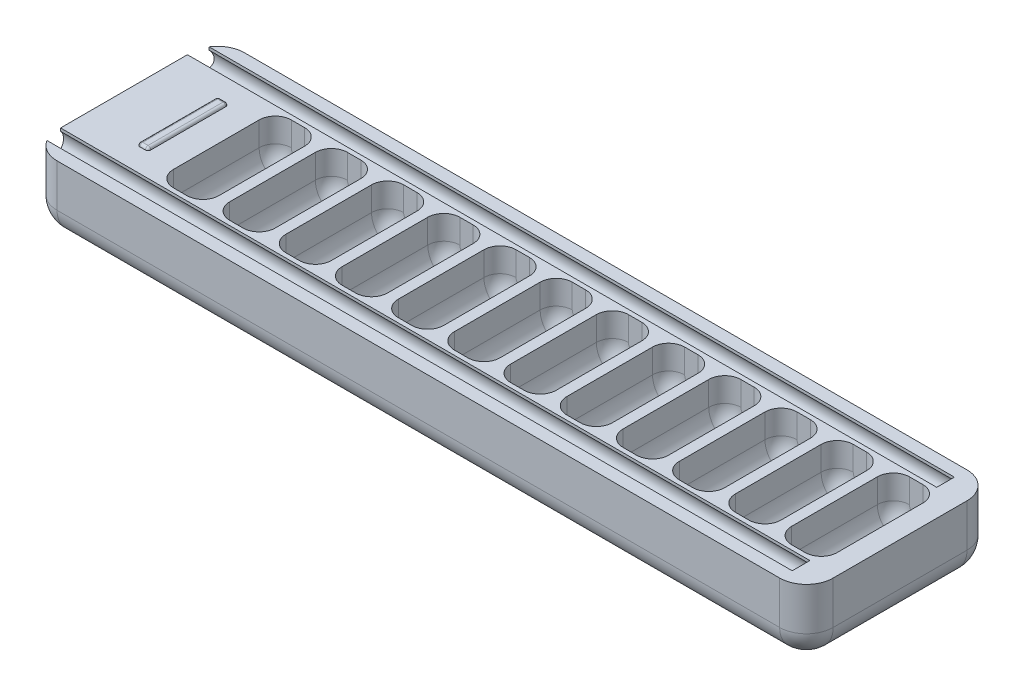
from build123d import *

# Parameters (mm, degrees)
SKETCH_1_W             = 145
SKETCH_1_H             = 35
EXTRUDE_1_DEPTH        = 13
FILLET_1_R             = 5
FILLET_2_R             = 5
CUT_EXTRUDE_1_DEPTH    = 11
PATTERN_LINEAR_1_COUNT = 12
PATTERN_LINEAR_1_PITCH = 10.5
SKETCH_3_R             = 2.2
SKETCH_3_W             = 3.3
SKETCH_3_H             = 4.4
CUT_EXTRUDE_2_DEPTH    = 140
FILLET_3_R             = 3
FILLET_4_R             = 3
SKETCH_4_W             = 2
SKETCH_4_H             = 15
EXTRUDE_2_DEPTH        = 0.5
FILLET_5_R             = 0.5


# Some blends are built 0.0001 mm under size
with BuildPart() as part:
    # 草图1 → 凸台-拉伸1 (new body)
    with BuildSketch(Plane(origin=(0, 0, 0), x_dir=(1, 0, 0), z_dir=(0, 1, 0))):
        Rectangle(SKETCH_1_W, SKETCH_1_H)
    extrude(amount=EXTRUDE_1_DEPTH)

    # 圆角1
    fillet_1_edges = [part.edges().sort_by_distance(p)[0] for p in [
        (0, 0, 17.5),
        (-72.5, 0, 0),
        (0, 0, -17.5),
        (72.5, 0, 0),
    ]]
    fillet(fillet_1_edges, radius=FILLET_1_R)

    # 圆角2
    # the kernel refuses this fillet: 5 mm, written as the material it takes off along each edge
    with BuildSketch(Plane(origin=(67.5, 5, -12.5), x_dir=(1, 0, 0), z_dir=(0, 0, -1))) as fillet_2_piece_1_section:
        Polygon((0, 0), (FILLET_2_R, 0), (FILLET_2_R, FILLET_2_R), (0, FILLET_2_R), align=None)
    fillet_2_piece_1 = extrude(amount=FILLET_2_R, mode=Mode.PRIVATE)
    fillet_2_piece_1 = fillet_2_piece_1 - Plane(origin=(67.5, 5, -12.5), x_dir=(-0.7071067811865475, 0.7071067811865475, 0), z_dir=(0, 0, -1)) * Sphere(FILLET_2_R, mode=Mode.PRIVATE)
    add(fillet_2_piece_1, mode=Mode.SUBTRACT)
    with BuildSketch(Plane(origin=(67.5, 5, 12.5), x_dir=(0, 0, 1), z_dir=(1, 0, 0))) as fillet_2_piece_2_section:
        Polygon((0, 0), (FILLET_2_R, 0), (FILLET_2_R, FILLET_2_R), (0, FILLET_2_R), align=None)
    fillet_2_piece_2 = extrude(amount=FILLET_2_R, mode=Mode.PRIVATE)
    fillet_2_piece_2 = fillet_2_piece_2 - Plane(origin=(67.5, 5, 12.5), x_dir=(0, 0.7071067811865475, -0.7071067811865475), z_dir=(1, 0, 0)) * Sphere(FILLET_2_R, mode=Mode.PRIVATE)
    add(fillet_2_piece_2, mode=Mode.SUBTRACT)
    with BuildSketch(Plane(origin=(-67.5, 5, -12.5), x_dir=(-1, 0, 0), z_dir=(0, 0, -1))) as fillet_2_piece_3_section:
        Polygon((0, 0), (FILLET_2_R, 0), (FILLET_2_R, -FILLET_2_R), (0, -FILLET_2_R), align=None)
    fillet_2_piece_3 = extrude(amount=FILLET_2_R, mode=Mode.PRIVATE)
    fillet_2_piece_3 = fillet_2_piece_3 - Plane(origin=(-67.5, 5, -12.5), x_dir=(0.7071067811865475, 0.7071067811865475, 0), z_dir=(0, 0, -1)) * Sphere(FILLET_2_R, mode=Mode.PRIVATE)
    add(fillet_2_piece_3, mode=Mode.SUBTRACT)
    with BuildSketch(Plane(origin=(-67.5, 5, 12.5), x_dir=(0, 0, 1), z_dir=(-1, 0, 0))) as fillet_2_piece_4_section:
        Polygon((0, 0), (FILLET_2_R, 0), (FILLET_2_R, -FILLET_2_R), (0, -FILLET_2_R), align=None)
    fillet_2_piece_4 = extrude(amount=FILLET_2_R, mode=Mode.PRIVATE)
    fillet_2_piece_4 = fillet_2_piece_4 - Plane(origin=(-67.5, 5, 12.5), x_dir=(0, 0.7071067811865475, -0.7071067811865475), z_dir=(-1, 0, 0)) * Sphere(FILLET_2_R, mode=Mode.PRIVATE)
    add(fillet_2_piece_4, mode=Mode.SUBTRACT)
    with BuildSketch(Plane(origin=(72.5, 5, 17.5), x_dir=(0, 0, -1), z_dir=(0, 1, 0)), Plane(origin=(72.5, 5, -17.5), x_dir=(-1, 0, 0), z_dir=(0, 1, 0))) as fillet_2_piece_5:
        with BuildLine():
            CenterArc((FILLET_2_R, FILLET_2_R), FILLET_2_R, 180, 90)
            Line((0, FILLET_2_R), (0, 0))
            Line((0, 0), (FILLET_2_R, 0))
        make_face()
    extrude(amount=20.5, mode=Mode.SUBTRACT)
    with BuildSketch(Plane(origin=(-72.5, 5, 17.5), x_dir=(0, 0, -1), z_dir=(0, 1, 0)), Plane(origin=(-72.5, 5, -17.5), x_dir=(1, 0, 0), z_dir=(0, 1, 0))) as fillet_2_piece_6:
        with BuildLine():
            CenterArc((FILLET_2_R, -FILLET_2_R), FILLET_2_R, 90, 90)
            Line((0, -FILLET_2_R), (0, 0))
            Line((0, 0), (FILLET_2_R, 0))
        make_face()
    extrude(amount=20.5, mode=Mode.SUBTRACT)

    # 草图2 → 切除-拉伸1 (cut, symmetric)
    with BuildSketch(Plane.XY):
        with BuildLine():
            Line((-55.25, 13), (-55.25, 8.5))
            ThreePointArc((-55.25, 8.5), (-51, 4.25), (-46.75, 8.5))
            Line((-46.75, 8.5), (-46.75, 13))
            Line((-46.75, 13), (-55.25, 13))
        make_face()
    cut_extrude_1 = extrude(amount=CUT_EXTRUDE_1_DEPTH, both=True, mode=Mode.SUBTRACT)

    # 阵列(线性)1: 切除-拉伸1 ×12
    with Locations(*[(i * PATTERN_LINEAR_1_PITCH, 0, 0) for i in range(1, PATTERN_LINEAR_1_COUNT)]):
        add(cut_extrude_1, mode=Mode.SUBTRACT)

    # 草图3 → 切除-拉伸2 (cut)
    with BuildSketch(Plane.ZY.offset(72.5)):
        with Locations((-13.5, 11)):
            Circle(SKETCH_3_R)
        with Locations((13.5, 11)):
            Circle(SKETCH_3_R)
        with Locations((-13.5, 13.2)):
            Rectangle(SKETCH_3_W, SKETCH_3_H)
        with Locations((13.5, 13.2)):
            Rectangle(SKETCH_3_W, SKETCH_3_H)
    extrude(amount=-CUT_EXTRUDE_2_DEPTH, mode=Mode.SUBTRACT)

    # 圆角3
    fillet_3_edges = [part.edges().sort_by_distance(p)[0] for p in [
        (-34.25, 10.75, 11),
        (-30, 4.25, -11),
        (-25.75, 10.75, 11),
        (-30, 4.25, 11),
        (-34.25, 10.75, -11),
        (-25.75, 10.75, -11),
        (-23.75, 10.75, 11),
        (-19.5, 4.25, -11),
        (-15.25, 10.75, 11),
        (-19.5, 4.25, 11),
        (-23.75, 10.75, -11),
        (-15.25, 10.75, -11),
        (-13.25, 10.75, 11),
        (-9, 4.25, -11),
        (-4.75, 10.75, 11),
        (-9, 4.25, 11),
        (-13.25, 10.75, -11),
        (-4.75, 10.75, -11),
        (-2.75, 10.75, 11),
        (1.5, 4.25, -11),
        (5.75, 10.75, 11),
        (1.5, 4.25, 11),
        (-2.75, 10.75, -11),
        (5.75, 10.75, -11),
        (7.75, 10.75, 11),
        (12, 4.25, -11),
        (16.25, 10.75, 11),
        (12, 4.25, 11),
        (7.75, 10.75, -11),
        (16.25, 10.75, -11),
        (18.25, 10.75, 11),
        (22.5, 4.25, -11),
        (26.75, 10.75, 11),
        (22.5, 4.25, 11),
        (18.25, 10.75, -11),
        (26.75, 10.75, -11),
        (28.75, 10.75, 11),
        (33, 4.25, -11),
        (37.25, 10.75, 11),
        (33, 4.25, 11),
        (28.75, 10.75, -11),
        (37.25, 10.75, -11),
        (-55.25, 10.75, 11),
        (-51, 4.25, -11),
        (-46.75, 10.75, 11),
        (-51, 4.25, 11),
        (-55.25, 10.75, -11),
        (-46.75, 10.75, -11),
        (-44.75, 10.75, 11),
        (-40.5, 4.25, -11),
        (-36.25, 10.75, 11),
        (-40.5, 4.25, 11),
        (-44.75, 10.75, -11),
        (-36.25, 10.75, -11),
    ]]
    fillet(fillet_3_edges, radius=FILLET_3_R)

    # 圆角4
    fillet_4_edges = [part.edges().sort_by_distance(p)[0] for p in [
        (39.25, 10.75, 11),
        (43.5, 4.25, -11),
        (47.75, 10.75, 11),
        (43.5, 4.25, 11),
        (39.25, 10.75, -11),
        (47.75, 10.75, -11),
        (49.75, 10.75, 11),
        (54, 4.25, -11),
        (58.25, 10.75, 11),
        (54, 4.25, 11),
        (49.75, 10.75, -11),
        (58.25, 10.75, -11),
        (60.25, 10.75, 11),
        (64.5, 4.25, -11),
        (68.75, 10.75, 11),
        (64.5, 4.25, 11),
        (60.25, 10.75, -11),
        (68.75, 10.75, -11),
    ]]
    fillet(fillet_4_edges, radius=FILLET_4_R)

    # 草图4 → 凸台-拉伸2 (add)
    with BuildSketch(Plane(origin=(0, 13, 0), x_dir=(1, 0, 0), z_dir=(0, 1, 0))):
        with Locations((-61.5, 0)):
            Rectangle(SKETCH_4_W, SKETCH_4_H)
    extrude(amount=EXTRUDE_2_DEPTH)

    # 圆角5
    fillet_5_edges = [part.edges().sort_by_distance(p)[0] for p in [
        (-62.5, 13.25, -7.5),
        (-62.5, 13.25, 7.5),
        (-60.5, 13.25, 7.5),
        (-60.5, 13.25, -7.5),
        (-62.5, 13.5, 0),
        (-61.5, 13.5, 7.5),
        (-60.5, 13.5, 0),
        (-61.5, 13.5, -7.5),
    ]]
    fillet(fillet_5_edges, radius=FILLET_5_R - 0.0001)  # a hair under: the kernel refuses the full size


solid = part.part
